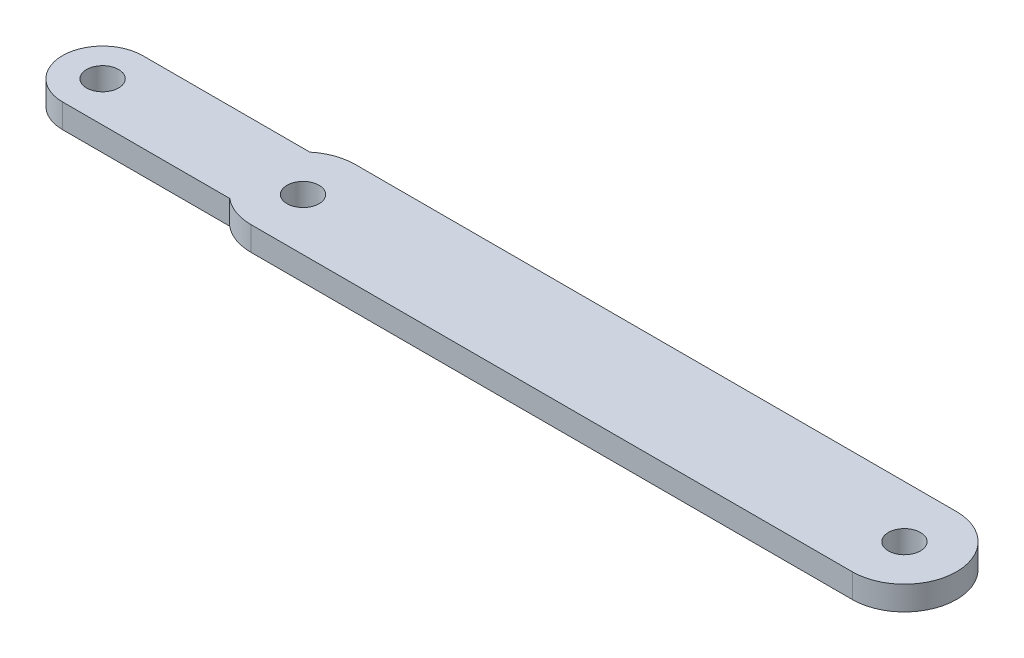
from build123d import *

# Parameters (mm, degrees)
SKETCH2_R           = 2
BOSS_EXTRUDE1_DEPTH = 3


with BuildPart() as part:
    # Sketch2 → Boss-Extrude1 (new body)
    with BuildSketch(Plane(origin=(0, 0, 0), x_dir=(1, 0, 0), z_dir=(0, 1, 0))):
        with BuildLine():
            Line((87.593623105, 198.818492307), (12.593623105, 198.818492307))
            ThreePointArc((12.593623105, 198.818492307), (10.385682888, 198.432001937), (8.440311173, 197.318492307))
            Line((8.440311173, 197.318492307), (-12.406376895, 197.318492307))
            ThreePointArc((-12.406376895, 197.318492307), (-17.406376895, 192.318492307), (-12.406376895, 187.318492307))
            Line((-12.406376895, 187.318492307), (8.440311173, 187.318492307))
            ThreePointArc((8.440311173, 187.318492307), (10.385682888, 186.204982677), (12.593623105, 185.818492307))
            Line((12.593623105, 185.818492307), (87.593623105, 185.818492307))
            ThreePointArc((87.593623105, 185.818492307), (94.093623105, 192.318492307), (87.593623105, 198.818492307))
        make_face()
        with Locations((12.593623105, 192.318492307)):
            Circle(SKETCH2_R, mode=Mode.SUBTRACT)
        with Locations((87.593623105, 192.318492307)):
            Circle(SKETCH2_R, mode=Mode.SUBTRACT)
        with Locations((-12.406376895, 192.318492307)):
            Circle(SKETCH2_R, mode=Mode.SUBTRACT)
    extrude(amount=BOSS_EXTRUDE1_DEPTH)


solid = part.part
